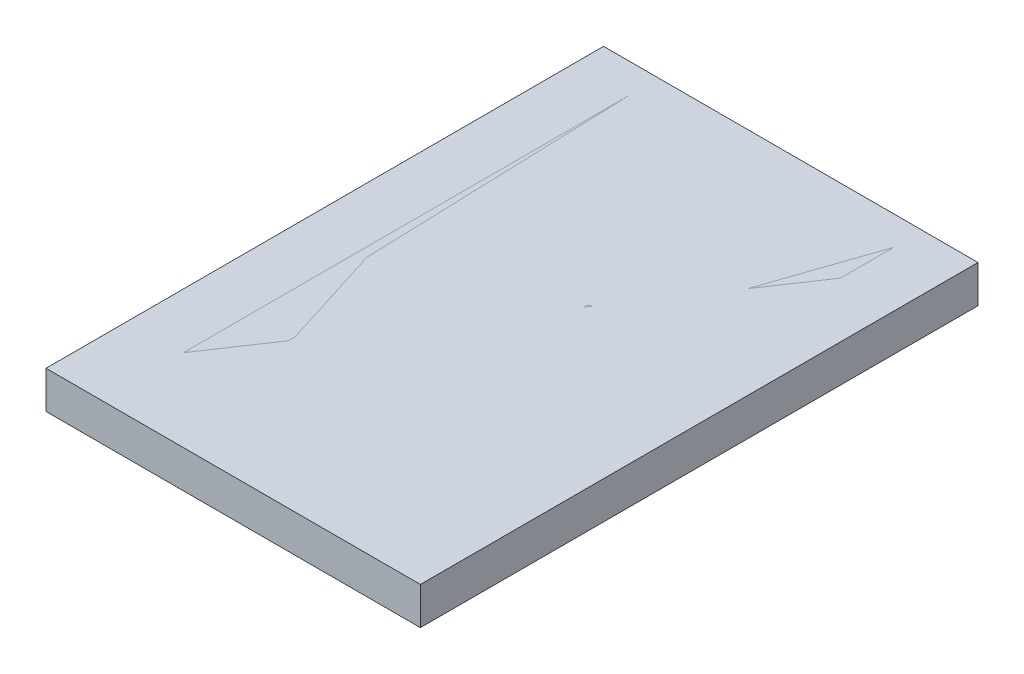
from build123d import *

# Parameters (mm, degrees)
SKETCH1_W           = 56.4
SKETCH1_H           = 112.8
BOSS_EXTRUDE1_DEPTH = 8
SKETCH2_R           = 19.25
CUT_EXTRUDE1_DEPTH  = 2
SKETCH3_R           = 5
CUT_EXTRUDE2_DEPTH  = 127.256881001
SKETCH4_R           = 2.65
CUT_EXTRUDE3_DEPTH  = 127.367717396
SKETCH5_R           = 14
CUT_EXTRUDE4_DEPTH  = 127.367717396
FILLET2_R           = 3
SKETCH6_W           = 80
SKETCH6_H           = 119.15
BOSS_EXTRUDE2_DEPTH = 8


with BuildPart() as part:
    # Sketch1 → Boss-Extrude1 (new body)
    with BuildSketch(Plane(origin=(0, 0, 0), x_dir=(1, 0, 0), z_dir=(0, 1, 0))):
        with Locations((28.2, -56.4)):
            Rectangle(SKETCH1_W, SKETCH1_H)
    extrude(amount=BOSS_EXTRUDE1_DEPTH)

    # Sketch2 → Cut-Extrude1 (cut)
    with BuildSketch(Plane(origin=(0, 8, 0), x_dir=(1, 0, 0), z_dir=(0, 1, 0))):
        with Locations((28.2, -28.2)):
            Circle(SKETCH2_R)
    cut_extrude1 = extrude(amount=-CUT_EXTRUDE1_DEPTH, mode=Mode.SUBTRACT)

    # Sketch3 → Cut-Extrude2 (cut, through all)
    with BuildSketch(Plane(origin=(0, 6, 0), x_dir=(1, 0, 0), z_dir=(0, 1, 0))):
        with Locations((28.2, -28.2)):
            Circle(SKETCH3_R)
    extrude(amount=-CUT_EXTRUDE2_DEPTH, mode=Mode.SUBTRACT)

    # Sketch4 → Cut-Extrude3 (cut, through all)
    with BuildSketch(Plane(origin=(0, 8, 0), x_dir=(1, 0, 0), z_dir=(0, 1, 0))):
        with Locations((4.58, -4.58)):
            Circle(SKETCH4_R)
        with Locations((51.82, -4.58)):
            Circle(SKETCH4_R)
        with Locations((51.82, -51.82)):
            Circle(SKETCH4_R)
        with Locations((4.58, -51.82)):
            Circle(SKETCH4_R)
    cut_extrude3 = extrude(amount=-CUT_EXTRUDE3_DEPTH, mode=Mode.SUBTRACT)

    # Sketch5 → Cut-Extrude4 (cut, through all)
    with BuildSketch(Plane(origin=(0, 8, 0), x_dir=(1, 0, 0), z_dir=(0, 1, 0))):
        with Locations((28.2, -84.6)):
            Circle(SKETCH5_R)
    extrude(amount=-CUT_EXTRUDE4_DEPTH, mode=Mode.SUBTRACT)

    # Mirror1: Cut-Extrude3 across plane
    add(cut_extrude3.mirror(Plane.XY.offset(56.4)), mode=Mode.SUBTRACT)

    # Mirror2: Cut-Extrude1 across plane
    add(cut_extrude1.mirror(Plane.XY.offset(56.4)), mode=Mode.SUBTRACT)

    # Fillet2
    fillet2_edges = [part.edges().sort_by_distance(p)[0] for p in [
        (0, 4, 0),
        (56.4, 4, 0),
        (56.4, 4, 112.8),
        (0, 4, 112.8),
    ]]
    fillet(fillet2_edges, radius=FILLET2_R)


with BuildPart() as body_2:
    # Sketch6 → Boss-Extrude2 (new body)
    with BuildSketch(Plane(origin=(0, 8, 0), x_dir=(1, 0, 0), z_dir=(0, 1, 0))):
        with Locations((28.2, -56.4)):
            Rectangle(SKETCH6_W, SKETCH6_H)
    extrude(amount=-BOSS_EXTRUDE2_DEPTH)


solid = Compound([part.part, body_2.part])
